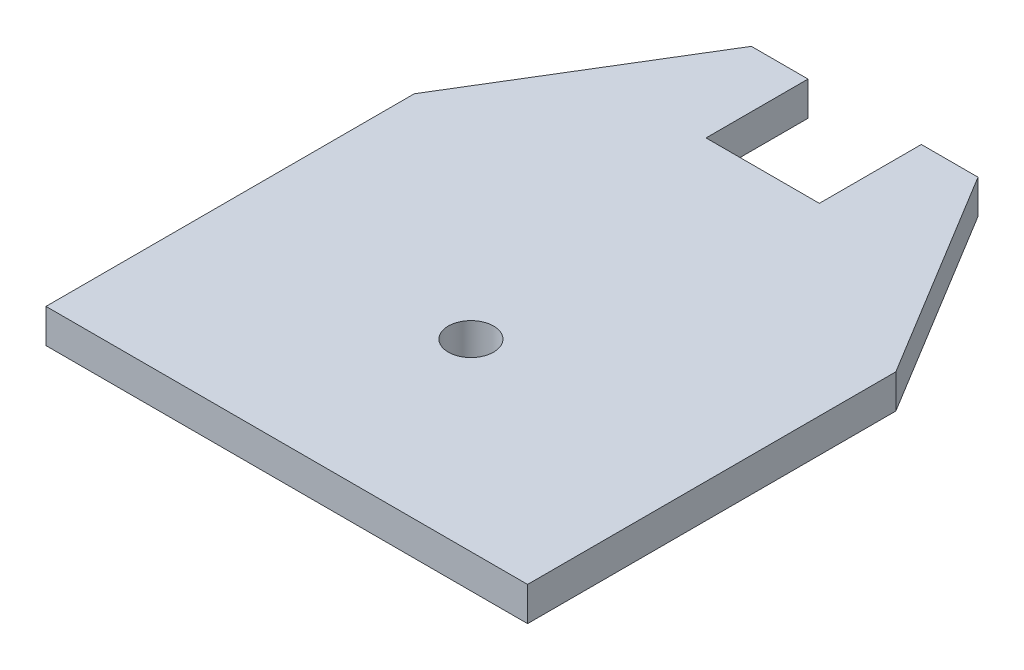
from build123d import *

# Parameters (mm, degrees)
SKETCH_1_W          = 85
SKETCH_1_H          = 102
EXTRUDE_1_DEPTH     = 6
CUT_EXTRUDE_1_DEPTH = 75.861411438
SKETCH_3_R          = 4
CUT_EXTRUDE_2_DEPTH = 75.861411438
SKETCH_4_W          = 20
SKETCH_4_H          = 18
CUT_EXTRUDE_3_DEPTH = 75.861411438


with BuildPart() as part:
    # Эскиз1 → Вытянуть1 (new body)
    with BuildSketch(Plane(origin=(0, 0, 0), x_dir=(1, 0, 0), z_dir=(0, 1, 0))):
        with Locations((0, -10.334989382)):
            Rectangle(SKETCH_1_W, SKETCH_1_H)
    extrude(amount=EXTRUDE_1_DEPTH)

    # Эскиз2 → Вырез-Вытянуть1 (cut, through all)
    with BuildSketch(Plane(origin=(0, 6, 0), x_dir=(1, 0, 0), z_dir=(0, 1, 0))):
        Polygon((42.5, 3.665010618), (20, 40.665010618), (42.5, 40.665010618), align=None)
        Polygon((-42.5, 40.665010618), (-42.5, 3.665010618), (-20, 40.665010618), align=None)
    extrude(amount=-CUT_EXTRUDE_1_DEPTH, mode=Mode.SUBTRACT)

    # Эскиз3 → Вырез-Вытянуть2 (cut, through all)
    with BuildSketch(Plane(origin=(0, 6, 0), x_dir=(1, 0, 0), z_dir=(0, 1, 0))):
        with Locations((0, -28.834989382)):
            Circle(SKETCH_3_R)
    extrude(amount=-CUT_EXTRUDE_2_DEPTH, mode=Mode.SUBTRACT)

    # Эскиз4 → Вырез-Вытянуть3 (cut, through all)
    with BuildSketch(Plane(origin=(0, 6, 0), x_dir=(1, 0, 0), z_dir=(0, 1, 0))):
        with Locations((3.2e-08, 31.665010618)):
            Rectangle(SKETCH_4_W, SKETCH_4_H)
    extrude(amount=-CUT_EXTRUDE_3_DEPTH, mode=Mode.SUBTRACT)


solid = part.part
